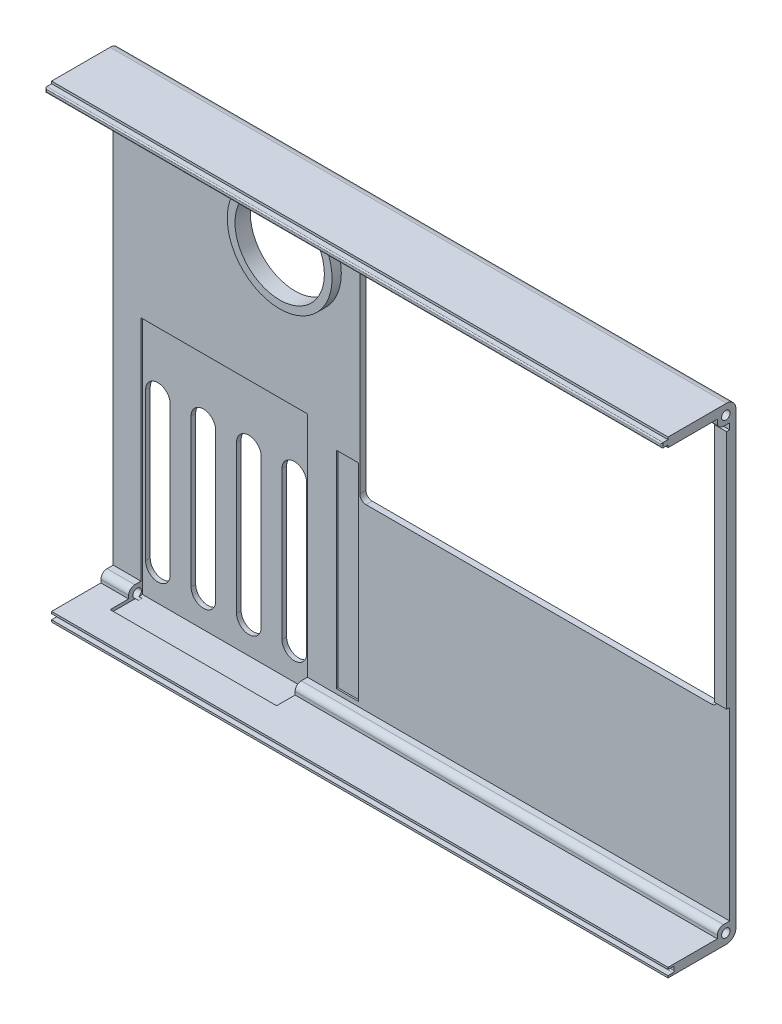
from build123d import *
from build123d.topology import SkipClean

# Parameters (mm, degrees)
SKETCH1_W                = 200
SKETCH1_H                = 152
BODY_DEPTH               = 2
SKETCH3_R                = 14.5
FAN_EXHAUST_GRILL_DEPTH  = 139.567397543
SKETCH12_W               = 200
SKETCH12_H               = 6
SIDE_WALLS_DEPTH         = 20
MOUNT_HOLES_L_DEPTH      = 221.580877825
MOUNT_HOLES_L_DEPTH_BACK = 10
SKETCH14_R               = 1.375
MOUNT_HOLES_R_START      = -10
SKETCH16_R               = 1.375
MOUNT_HOLES_R_DEPTH      = 10
SKETCH18_W               = 16
SKETCH18_H               = 3
WALL_REDUCE_DEPTH        = 221.580877825
SKETCH19_W               = 200
SKETCH19_H               = 1.7
GROOVE_DEPTH             = 2
SKETCH20_W               = 200
SKETCH20_H               = 1.5
NOTCH_DEPTH              = 2
SKETCH21_W               = 116
SKETCH21_H               = 81
BATT_CUT_DEPTH           = 141.288715376
FILLET1_R                = 3
FILLET2_R                = 2
FILLET3_R                = 0.4
FILLET4_R                = 2
SKETCH22_R               = 17
SKETCH22_R_2             = 14.5
FAN_HOLE_SUPP_DEPTH      = 3
SKETCH23_W               = 4
SKETCH23_H               = 78
BATT_CUT_SUPP_DEPTH      = 1
CUT_EXTRUDE1_START       = 10
SKETCH24_W               = 54
SKETCH24_H               = 78
SKETCH24_W_2             = 7
SKETCH24_H_2             = 67
CUT_EXTRUDE1_DEPTH       = 10.5


with BuildPart() as part:
    # Sketch1 → body (new body)
    with BuildSketch(Plane.XY):
        with Locations((5, -14.39869281)):
            Rectangle(SKETCH1_W, SKETCH1_H)
    extrude(amount=BODY_DEPTH)

    # Sketch3 → fan_exhaust_grill (cut, through all)
    with BuildSketch(Plane(origin=(0, 0, 0), x_dir=(-1, 0, 0), z_dir=(0, 0, -1))):
        with Locations((38, 34.60130719)):
            Circle(SKETCH3_R)
        with BuildLine():
            Line((62.25, -78.39869281), (62.25, -30.39869281))
            ThreePointArc((62.25, -30.39869281), (66.25, -26.39869281), (70.25, -30.39869281))
            Line((70.25, -30.39869281), (70.25, -78.39869281))
            ThreePointArc((70.25, -78.39869281), (66.25, -82.39869281), (62.25, -78.39869281))
        make_face()
        with BuildLine():
            Line((77, -78.39869281), (77, -30.39869281))
            ThreePointArc((77, -30.39869281), (81, -26.39869281), (85, -30.39869281))
            Line((85, -30.39869281), (85, -78.39869281))
            ThreePointArc((85, -78.39869281), (81, -82.39869281), (77, -78.39869281))
        make_face()
        with BuildLine():
            Line((47.5, -78.39869281), (47.5, -30.39869281))
            ThreePointArc((47.5, -30.39869281), (51.5, -26.39869281), (55.5, -30.39869281))
            Line((55.5, -30.39869281), (55.5, -78.39869281))
            ThreePointArc((55.5, -78.39869281), (51.5, -82.39869281), (47.5, -78.39869281))
        make_face()
        with BuildLine():
            Line((32.75, -78.39869281), (32.75, -30.39869281))
            ThreePointArc((32.75, -30.39869281), (36.75, -26.39869281), (40.75, -30.39869281))
            Line((40.75, -30.39869281), (40.75, -78.39869281))
            ThreePointArc((40.75, -78.39869281), (36.75, -82.39869281), (32.75, -78.39869281))
        make_face()
    extrude(amount=-FAN_EXHAUST_GRILL_DEPTH, mode=Mode.SUBTRACT)

    # Sketch12 → side_walls (add)
    with BuildSketch(Plane.XY.offset(2)):
        with Locations((5, -87.39869281)):
            Rectangle(SKETCH12_W, SKETCH12_H)
        with Locations((5, 58.60130719)):
            Rectangle(SKETCH12_W, SKETCH12_H)
    extrude(amount=SIDE_WALLS_DEPTH)

    # Sketch14 → mount_holes_l (cut, two sides: drawn at the far end of the back side and taken through both)
    with BuildSketch(Plane(origin=(105, 0, 0), x_dir=(0, 0, -1), z_dir=(1, 0, 0)).offset(-MOUNT_HOLES_L_DEPTH_BACK)):
        with Locations((-3.25, -87.14869281)):
            Circle(SKETCH14_R)
        with Locations((-3.25, 58.35130719)):
            Circle(SKETCH14_R)
    extrude(amount=MOUNT_HOLES_L_DEPTH + MOUNT_HOLES_L_DEPTH_BACK, mode=Mode.SUBTRACT)

    # Sketch16 → mount_holes_r (cut)
    with BuildSketch(Plane.ZY.offset(95).offset(MOUNT_HOLES_R_START)):
        with Locations((3.25, -87.14869281)):
            Circle(SKETCH16_R)
        with Locations((3.25, 58.35130719)):
            Circle(SKETCH16_R)
    extrude(amount=MOUNT_HOLES_R_DEPTH, mode=Mode.SUBTRACT)

    # Sketch18 → wall_reduce (cut, through all)
    with BuildSketch(Plane(origin=(105, 0, 0), x_dir=(0, 0, -1), z_dir=(1, 0, 0))):
        with Locations((-14, -85.89869281)):
            Rectangle(SKETCH18_W, SKETCH18_H)
        with Locations((-14, 57.10130719)):
            Rectangle(SKETCH18_W, SKETCH18_H)
    extrude(amount=-WALL_REDUCE_DEPTH, mode=Mode.SUBTRACT)

    # Sketch19 → groove (cut)
    with BuildSketch(Plane.XY.offset(22)):
        with Locations((5, -88.89869281)):
            Rectangle(SKETCH19_W, SKETCH19_H)
    extrude(amount=-GROOVE_DEPTH, mode=Mode.SUBTRACT)

    # Sketch20 → notch (add)
    with BuildSketch(Plane.XY.offset(22)):
        with Locations((5, 60.10130719)):
            Rectangle(SKETCH20_W, SKETCH20_H)
    extrude(amount=NOTCH_DEPTH)

    # Sketch21 → batt_cut (cut, through all)
    with BuildSketch(Plane.XY.offset(2)):
        with Locations((43, 14.10130719)):
            Rectangle(SKETCH21_W, SKETCH21_H)
    extrude(amount=-BATT_CUT_DEPTH, mode=Mode.SUBTRACT)

    # Fillet1
    fillet1_edges = [part.edges().sort_by_distance(p)[0] for p in [
        (5, -90.39869281, 0),
        (5, 61.60130719, 0),
    ]]
    fillet(fillet1_edges, radius=FILLET1_R)

    # Fillet2
    fillet2_edges = [part.edges().sort_by_distance(p)[0] for p in [
        (5, -84.39869281, 6),
        (5, 55.60130719, 6),
    ]]
    fillet(fillet2_edges, radius=FILLET2_R)

    # Fillet3
    fillet3_edges = [part.edges().sort_by_distance(p)[0] for p in [
        (5, 60.85130719, 24),
        (105, 60.10130719, 24),
        (5, 59.35130719, 24),
        (-95, 60.10130719, 24),
        (5, -89.74869281, 20),
        (5, -88.04869281, 20),
    ]]
    fillet(fillet3_edges, radius=FILLET3_R)

    # Fillet4
    fillet4_edges = [part.edges().sort_by_distance(p)[0] for p in [
        (-15, -26.39869281, 1),
        (101, -26.39869281, 1),
        (101, 54.60130719, 1),
        (-15, 54.60130719, 1),
    ]]
    fillet(fillet4_edges, radius=FILLET4_R)

    # Sketch22 → fan_hole_supp (add)
    with SkipClean():  # the faces are left unmerged after this step: merging them gives an invalid solid
        with BuildSketch(Plane.XY.offset(2)):
            with Locations((-38, 34.60130719)):
                Circle(SKETCH22_R)
            with Locations((-38, 34.60130719)):
                Circle(SKETCH22_R_2, mode=Mode.SUBTRACT)
        extrude(amount=FAN_HOLE_SUPP_DEPTH)

    # Sketch23 → batt_cut_supp (add)
    with SkipClean():  # the faces are left unmerged after this step: merging them gives an invalid solid
        with BuildSketch(Plane.XY.offset(2)):
            with Locations((103, 14.60130719)):
                Rectangle(SKETCH23_W, SKETCH23_H)
        extrude(amount=BATT_CUT_SUPP_DEPTH)

    # Sketch24 → Cut-Extrude1 (cut)
    with SkipClean():  # the faces are left unmerged after this step: merging them gives an invalid solid
        with BuildSketch(Plane.XY.offset(2).offset(CUT_EXTRUDE1_START)):
            with Locations((-59, -49.39869281)):
                Rectangle(SKETCH24_W, SKETCH24_H)
            with Locations((-19, -49.39869281)):
                Rectangle(SKETCH24_W_2, SKETCH24_H_2)
        extrude(amount=-CUT_EXTRUDE1_DEPTH, mode=Mode.SUBTRACT)


solid = part.part
